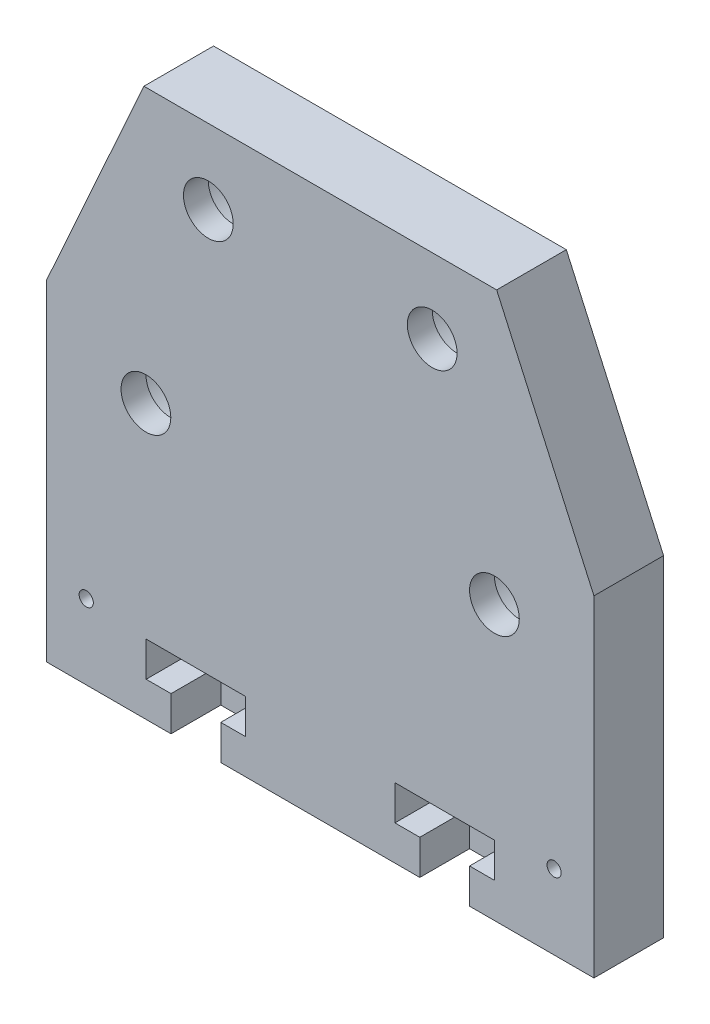
from build123d import *

# Parameters (mm, degrees)
SKETCH3_R           = 11.05
BOSS_EXTRUDE1_DEPTH = 14
CUT_EXTRUDE3_DEPTH  = 10
BOSS_EXTRUDE4_START = -5
SKETCH6_R           = 11.05
SKETCH6_R_2         = 6
BOSS_EXTRUDE4_DEPTH = 5
SKETCH8_R           = 1.425
CUT_EXTRUDE5_DEPTH  = 14
BOSS_EXTRUDE2_START = -5
SKETCH4_R           = 11.05
SKETCH4_R_2         = 5
BOSS_EXTRUDE2_DEPTH = 5


with BuildPart() as part:
    # Sketch3 → Boss-Extrude1 (new body)
    with BuildSketch(Plane.XY):
        Polygon((33.782364808, 5.02173913), (14.187228367, -38.569578566), (14.187228367, -104.97826087), (124.228904722, -104.97826087), (124.228904722, -38.463609741), (104.681403308, 5.02173913), align=None)
        with Locations((91.728904722, -9.97826087)):
            Circle(SKETCH3_R, mode=Mode.SUBTRACT)
        with Locations((46.728904722, -9.97826087)):
            Circle(SKETCH3_R, mode=Mode.SUBTRACT)
        with Locations((104.228904722, -49.97826087)):
            Circle(SKETCH3_R, mode=Mode.SUBTRACT)
        with Locations((34.187228367, -49.97826087)):
            Circle(SKETCH3_R, mode=Mode.SUBTRACT)
    extrude(amount=BOSS_EXTRUDE1_DEPTH)

    # Sketch5 → Cut-Extrude3 (cut)
    with BuildSketch(Plane.XY.offset(14)):
        Polygon((34.231884058, -97.97826087), (39.231884058, -97.97826087), (39.231884058, -104.97826087), (49.231884058, -104.97826087), (49.231884058, -97.97826087), (54.231884058, -97.97826087), (54.231884058, -90.97826087), (34.231884058, -90.97826087), align=None)
        Polygon((89.231884058, -97.97826087), (89.231884058, -104.97826087), (99.231884058, -104.97826087), (99.231884058, -97.97826087), (104.231884058, -97.97826087), (104.231884058, -90.97826087), (84.231884058, -90.97826087), (84.231884058, -97.97826087), align=None)
    extrude(amount=-CUT_EXTRUDE3_DEPTH, mode=Mode.SUBTRACT)

    # Sketch6 → Boss-Extrude4 (add)
    # profile 1 of 4: a face of its own
    with BuildSketch(Plane.XY.offset(14).offset(BOSS_EXTRUDE4_START)):
        with Locations((46.728904722, -9.97826087)):
            Circle(SKETCH6_R)
        with Locations((46.728904722, -9.97826087)):
            Circle(SKETCH6_R_2, mode=Mode.SUBTRACT)
    # profile 2 of 4: a face of its own
    with BuildSketch(Plane.XY.offset(14).offset(BOSS_EXTRUDE4_START)):
        with Locations((91.728904722, -9.97826087)):
            Circle(SKETCH6_R)
        with Locations((91.728904722, -9.97826087)):
            Circle(SKETCH6_R_2, mode=Mode.SUBTRACT)
    # profile 3 of 4: a face of its own
    with BuildSketch(Plane.XY.offset(14).offset(BOSS_EXTRUDE4_START)):
        with Locations((34.187228367, -49.97826087)):
            Circle(SKETCH6_R)
        with Locations((34.187228367, -49.97826087)):
            Circle(SKETCH6_R_2, mode=Mode.SUBTRACT)
    # profile 4 of 4: a face of its own
    with BuildSketch(Plane.XY.offset(14).offset(BOSS_EXTRUDE4_START)):
        with Locations((104.228904722, -49.97826087)):
            Circle(SKETCH6_R)
        with Locations((104.228904722, -49.97826087)):
            Circle(SKETCH6_R_2, mode=Mode.SUBTRACT)
    extrude(amount=BOSS_EXTRUDE4_DEPTH)

    # Sketch8 → Cut-Extrude5 (cut)
    with BuildSketch(Plane.XY.offset(14)):
        with Locations((22.187228367, -89.97826087)):
            Circle(SKETCH8_R)
        with Locations((116.228904722, -89.97826087)):
            Circle(SKETCH8_R)
    extrude(amount=-CUT_EXTRUDE5_DEPTH, mode=Mode.SUBTRACT)

    # Sketch4 → Boss-Extrude2 (add)
    # profile 1 of 4: a face of its own
    with BuildSketch(Plane.XY.offset(14).offset(BOSS_EXTRUDE2_START)):
        with Locations((46.728904722, -9.97826087)):
            Circle(SKETCH4_R)
        with Locations((46.728904722, -9.97826087)):
            Circle(SKETCH4_R_2, mode=Mode.SUBTRACT)
    # profile 2 of 4: a face of its own
    with BuildSketch(Plane.XY.offset(14).offset(BOSS_EXTRUDE2_START)):
        with Locations((91.728904722, -9.97826087)):
            Circle(SKETCH4_R)
        with Locations((91.728904722, -9.97826087)):
            Circle(SKETCH4_R_2, mode=Mode.SUBTRACT)
    # profile 3 of 4: a face of its own
    with BuildSketch(Plane.XY.offset(14).offset(BOSS_EXTRUDE2_START)):
        with Locations((104.228904722, -49.97826087)):
            Circle(SKETCH4_R)
        with Locations((104.228904722, -49.97826087)):
            Circle(SKETCH4_R_2, mode=Mode.SUBTRACT)
    # profile 4 of 4: a face of its own
    with BuildSketch(Plane.XY.offset(14).offset(BOSS_EXTRUDE2_START)):
        with Locations((34.187228367, -49.97826087)):
            Circle(SKETCH4_R)
        with Locations((34.187228367, -49.97826087)):
            Circle(SKETCH4_R_2, mode=Mode.SUBTRACT)
    extrude(amount=BOSS_EXTRUDE2_DEPTH)


solid = part.part
